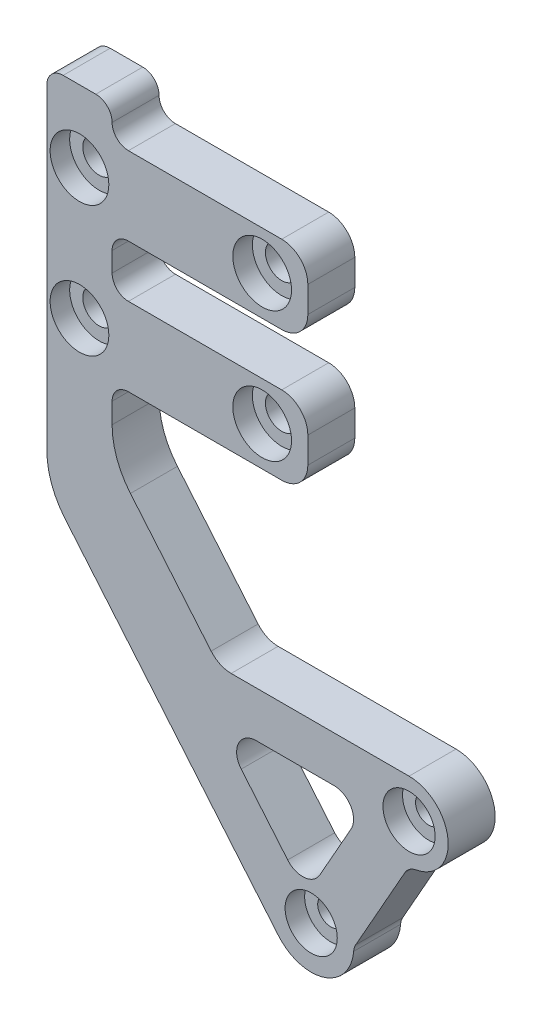
from build123d import *

# Parameters (mm, degrees)
SKETCH2_R            = 2.5
SKETCH2_R_2          = 2
BOSS_EXTRUDE1_DEPTH  = 7.2
MOVE_FACE1_OUTLINE_R = 2.5
MOVE_FACE1_DEPTH     = 7.2
CUT_EXTRUDE2_DEPTH   = 92.988260121
FILLET1_R            = 2.5
SKETCH5_R            = 2.5
CUT_EXTRUDE3_DEPTH   = 91.271536943
CUT_EXTRUDE4_DEPTH   = 91.271536943
SKETCH8_R            = 4.5
SKETCH8_R_2          = 4
CUT_EXTRUDE5_DEPTH   = 3


# Read off the part's stored shape, not the designer's step: Move Face1
with BuildPart() as part:
    # Sketch2 → Boss-Extrude1 (new body)
    with BuildSketch(Plane.XY):
        with BuildLine():
            Line((3, 4), (-33, 4))
            Line((-33, 4), (-33, -4))
            Line((-33, -4), (3, -4))
            ThreePointArc((3, -4), (5.828427125, -5.171572875), (7, -8))
            Line((7, -8), (7, -12))
            ThreePointArc((7, -12), (5.828427125, -14.828427125), (3, -16))
            Line((3, -16), (-33, -16))
            Line((-33, -16), (-33, -21.632357189))
            ThreePointArc((-33, -21.632357189), (-32.276311449, -25.736598909), (-30.192533317, -29.345808505))
            Line((-30.192533317, -29.345808505), (-17.821439842, -44.089103599))
            ThreePointArc((-17.821439842, -44.089103599), (-16.447735116, -45.143184308), (-14.757262069, -45.51795316))
            Line((-14.757262069, -45.51795316), (14.512756385, -45.51795316))
            ThreePointArc((14.512756385, -45.51795316), (17.34118351, -46.689526036), (18.512756385, -49.51795316))
            Line((18.512756385, -49.51795316), (18.512756385, -81))
            Line((18.512756385, -81), (8.861465874, -81))
            Line((8.861465874, -81), (1.705289702, -81))
            ThreePointArc((1.705289702, -81), (-3.366129439, -79.875693444), (-7.487243615, -76.713451316))
            Line((-7.487243615, -76.713451316), (-40.192533317, -37.736804817))
            ThreePointArc((-40.192533317, -37.736804817), (-42.276311449, -34.12759522), (-43, -30.023353501))
            Line((-43, -30.023353501), (-43, 21))
            Line((-43, 21), (-33, 21))
            Line((-33, 21), (-33, 16))
            Line((-33, 16), (3, 16))
            ThreePointArc((3, 16), (5.828427125, 14.828427125), (7, 12))
            Line((7, 12), (7, 8))
            ThreePointArc((7, 8), (5.828427125, 5.171572875), (3, 4))
        make_face()
        with Locations((0, 10)):
            Circle(SKETCH2_R, mode=Mode.SUBTRACT)
        with Locations(Location((0, -10, 0), (0, 0, 180))):
            Circle(SKETCH2_R, mode=Mode.SUBTRACT)
        with Locations((12.512756385, -51.51795316)):
            Circle(SKETCH2_R_2, mode=Mode.SUBTRACT)
        with Locations((-2.487243615, -72.51795316)):
            Circle(SKETCH2_R_2, mode=Mode.SUBTRACT)
    extrude(amount=BOSS_EXTRUDE1_DEPTH)

    # Move Face1 outline → Move Face1 (cut)
    # profile 1 of 4: a face of its own
    with BuildSketch(Plane.XY):
        with BuildLine():
            Line((-3, -8), (-3, -12))
            ThreePointArc((-3, -12), (-4.171572875, -14.828427125), (-7, -16))
            Line((-7, -16), (3, -16))
            ThreePointArc((3, -16), (5.828427125, -14.828427125), (7, -12))
            Line((7, -12), (7, -8))
            ThreePointArc((7, -8), (5.828427125, -5.171572875), (3, -4))
            Line((3, -4), (-7, -4))
            ThreePointArc((-7, -4), (-4.171572875, -5.171572875), (-3, -8))
        make_face()
        with Locations((0, -10)):
            Circle(MOVE_FACE1_OUTLINE_R, mode=Mode.SUBTRACT)
    # profile 2 of 4: a face of its own
    with BuildSketch(Plane.XY):
        with BuildLine():
            ThreePointArc((-7, 16), (-4.171572875, 14.828427125), (-3, 12))
            Line((-3, 12), (-3, 8))
            ThreePointArc((-3, 8), (-4.171572875, 5.171572875), (-7, 4))
            Line((-7, 4), (3, 4))
            ThreePointArc((3, 4), (5.828427125, 5.171572875), (7, 8))
            Line((7, 8), (7, 12))
            ThreePointArc((7, 12), (5.828427125, 14.828427125), (3, 16))
            Line((3, 16), (-7, 16))
        make_face()
        with Locations((0, 10)):
            Circle(MOVE_FACE1_OUTLINE_R, mode=Mode.SUBTRACT)
    # profile 3 of 4: a face of its own
    with BuildSketch(Plane.XY):
        with Locations((-10, 10)):
            Circle(MOVE_FACE1_OUTLINE_R)
    # profile 4 of 4: a face of its own
    with BuildSketch(Plane.XY):
        with Locations((-10, -10)):
            Circle(MOVE_FACE1_OUTLINE_R)
    extrude(amount=MOVE_FACE1_DEPTH, mode=Mode.SUBTRACT)

    # Sketch4 → Cut-Extrude2 (cut, through all)
    with BuildSketch(Plane.XY.offset(7.2)):
        with BuildLine():
            Line((12.512756385, -57.51795316), (4.039792831, -72.51795316))
            ThreePointArc((4.039792831, -72.51795316), (-0.254865674, -78.651361145), (-7.487243615, -76.713451316))
            Line((-7.487243615, -76.713451316), (-9.608649797, -88.557738574))
            Line((-9.608649797, -88.557738574), (26.411143911, -81.246796091))
            Line((26.411143911, -81.246796091), (26.411143911, -45.51795316))
            Line((26.411143911, -45.51795316), (12.512756385, -45.51795316))
            ThreePointArc((12.512756385, -45.51795316), (18.512756385, -51.51795316), (12.512756385, -57.51795316))
        make_face()
    extrude(amount=-CUT_EXTRUDE2_DEPTH, mode=Mode.SUBTRACT)

    # Fillet1
    fillet1_edges = [part.edges().sort_by_distance(p)[0] for p in [
        (12.512756385, -57.51795316, 3.6),
        (4.039792831, -72.51795316, 3.6),
        (-33, 16, 3.6),
        (-33, 4, 3.6),
        (-33, -4, 3.6),
        (-33, -16, 3.6),
        (-43, 21, 3.6),
        (-33, 21, 3.6),
    ]]
    fillet(fillet1_edges, radius=FILLET1_R - 0.0001)  # a hair under: the kernel refuses the full size

    # Sketch5 → Cut-Extrude3 (cut, through all)
    with BuildSketch(Plane.XY.offset(7.2)):
        with Locations((-38, 10)):
            Circle(SKETCH5_R)
        with Locations((-38, -10)):
            Circle(SKETCH5_R)
    extrude(amount=-CUT_EXTRUDE3_DEPTH, mode=Mode.SUBTRACT)

    # Sketch6 → Cut-Extrude4 (cut, through all)
    with BuildSketch(Plane.XY.offset(7.2)):
        with BuildLine():
            Line((1.008892165, -52.51795316), (-10.912898118, -52.51795316))
            ThreePointArc((-10.912898118, -52.51795316), (-13.631821479, -54.250098375), (-13.211031447, -57.446315989))
            Line((-13.211031447, -57.446315989), (-6.085798343, -65.937838139))
            ThreePointArc((-6.085798343, -65.937838139), (-3.512131749, -66.996795417), (-1.175581436, -65.484947907))
            Line((-1.175581436, -65.484947907), (3.620975743, -56.993425757))
            ThreePointArc((3.620975743, -56.993425757), (3.599878251, -54.005739186), (1.008892165, -52.51795316))
        make_face()
    extrude(amount=-CUT_EXTRUDE4_DEPTH, mode=Mode.SUBTRACT)

    # Sketch8 → Cut-Extrude5 (cut)
    with BuildSketch(Plane.XY.offset(7.2)):
        with Locations((-38, 10)):
            Circle(SKETCH8_R)
        with Locations((-10, 10)):
            Circle(SKETCH8_R)
        with Locations((-38, -10)):
            Circle(SKETCH8_R)
        with Locations((-10, -10)):
            Circle(SKETCH8_R)
        with Locations((12.512756385, -51.51795316)):
            Circle(SKETCH8_R_2)
        with Locations((-2.487243615, -72.51795316)):
            Circle(SKETCH8_R_2)
    extrude(amount=-CUT_EXTRUDE5_DEPTH, mode=Mode.SUBTRACT)


solid = part.part
